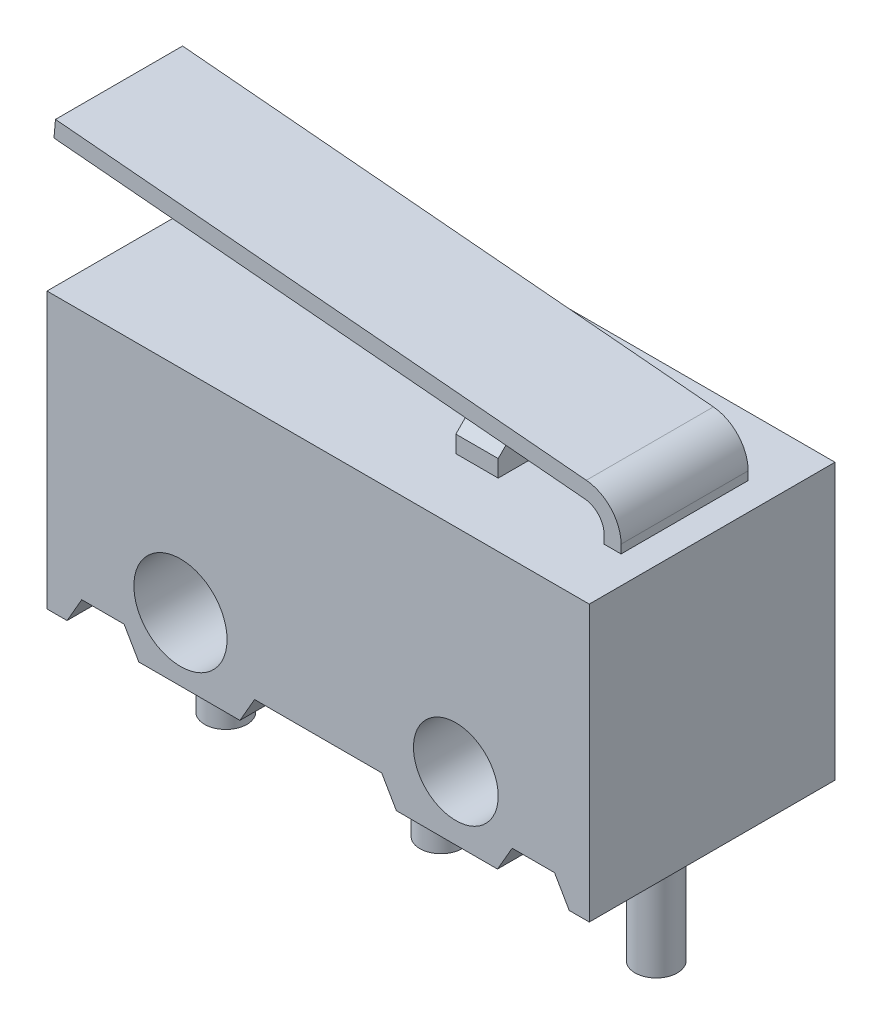
from build123d import *

# Parameters (mm, degrees)
SKETCH1_W           = 12.8
SKETCH1_H           = 6.5
SKETCH1_R           = 1.1
SKETCH1_R_2         = 1
BOSS_EXTRUDE1_DEPTH = 2.9
CUT_EXTRUDE4_DEPTH  = 10.97997996
SKETCH3_W           = 1
SKETCH3_H           = 0.9
BOSS_EXTRUDE2_DEPTH = 1.4
CHAMFER1_SIZE       = 0.5
SKETCH13_R          = 0.5
BOSS_EXTRUDE9_DEPTH = 3.5
BOSS_EXTRUDE8_DEPTH = 1.5


with BuildPart() as part:
    # Sketch1 → Boss-Extrude1 (new, symmetric)
    with BuildSketch(Plane.XY):
        with Locations((0, 1.75)):
            Rectangle(SKETCH1_W, SKETCH1_H)
        with Locations((-3.25, 0)):
            Circle(SKETCH1_R, mode=Mode.SUBTRACT)
        with Locations((3.25, 0)):
            Circle(SKETCH1_R_2, mode=Mode.SUBTRACT)
    extrude(amount=BOSS_EXTRUDE1_DEPTH, both=True)

    # Sketch12 → Cut-Extrude4 (cut, through all)
    with BuildSketch(Plane.XY.offset(2.9)):
        Polygon((-1.846410162, -1.5), (-1.5, -0.9), (1.5, -0.9), (1.846410162, -1.5), align=None)
        Polygon((-5.926410162, -1.5), (-5.58, -0.9), (-4.58, -0.9), (-4.233589838, -1.5), align=None)
        Polygon((4.233589838, -1.5), (5.926410162, -1.5), (5.58, -0.9), (4.58, -0.9), align=None)
    extrude(amount=-CUT_EXTRUDE4_DEPTH, mode=Mode.SUBTRACT)

    # Sketch3 → Boss-Extrude2 (add, symmetric)
    with BuildSketch(Plane.XY):
        with Locations((2.25, 5.45)):
            Rectangle(SKETCH3_W, SKETCH3_H)
    extrude(amount=BOSS_EXTRUDE2_DEPTH, both=True)

    # Chamfer1
    chamfer1_edges = [part.edges().sort_by_distance(p)[0] for p in [
        (2.25, 5.9, -1.4),
        (2.25, 5.9, 1.4),
    ]]
    chamfer(chamfer1_edges, length=CHAMFER1_SIZE)

    # Sketch13 → Boss-Extrude9 (add)
    with BuildSketch(Plane.XZ.offset(0.9)):
        Circle(SKETCH13_R)
        with Locations((-5.08, 0)):
            Circle(SKETCH13_R)
        with Locations((5.08, 0)):
            Circle(SKETCH13_R)
    extrude(amount=BOSS_EXTRUDE9_DEPTH)


with BuildPart() as body_2:
    # Sketch11 → Boss-Extrude8 (new, symmetric)
    with BuildSketch(Plane.XY):
        with BuildLine():
            Line((-7.635359223, 6.81), (4.894376977, 5.698042615))
            ThreePointArc((4.894376977, 5.698042615), (5.219027182, 5.537565168), (5.350177949, 5.2))
            Line((5.350177949, 5.2), (5.350177949, 5))
            Line((5.350177949, 5), (5.750177949, 5))
            Line((5.750177949, 5), (5.750177949, 5.2))
            ThreePointArc((5.750177949, 5.2), (5.514106569, 5.807617303), (4.929736199, 6.096476706))
            Line((4.929736199, 6.096476706), (-7.6, 7.208434092))
            Line((-7.6, 7.208434092), (-7.635359223, 6.81))
        make_face()
    extrude(amount=BOSS_EXTRUDE8_DEPTH, both=True)


solid = Compound([part.part, body_2.part])
